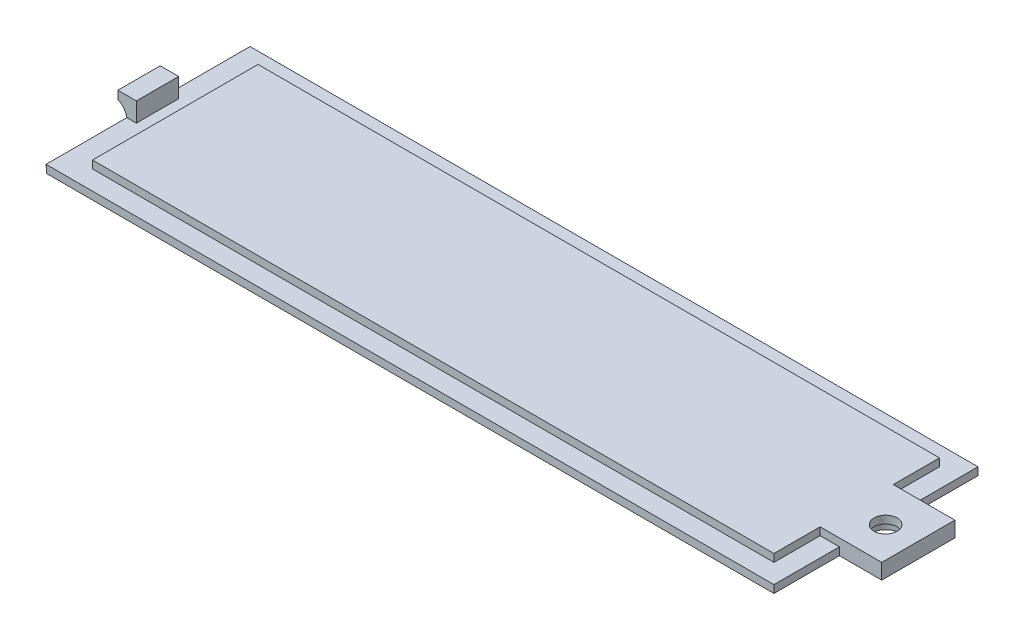
from build123d import *

# Parameters (mm, degrees)
BOSS_EXTRUDE1_DEPTH     = 1
CUT_EXTRUDE3_DEPTH      = 104.456512603
CUT_EXTRUDE3_DEPTH_BACK = 104.456512603
SKETCH6_R               = 2
SKETCH2_W               = 88.5
SKETCH2_H               = 21.5
BOSS_EXTRUDE2_DEPTH     = 1
SKETCH3_W               = 1.2
SKETCH3_H               = 5.5
BOSS_EXTRUDE3_DEPTH     = 2.5
SKETCH7_W               = 8
SKETCH7_H               = 9.5
BOSS_EXTRUDE4_DEPTH     = 1
SKETCH8_R               = 1.5
CUT_EXTRUDE4_DEPTH      = 3
SKETCH9_W               = 5.5
SKETCH9_H               = 1.039758998
BOSS_EXTRUDE5_DEPTH     = 1.2
FILLET3_START           = -16
FILLET3_DEPTH           = 5.5
FILLET3_START_2         = -26.5
FILLET3_2_DEPTH         = 26.5


with BuildPart() as part:
    # Sketch1 → Boss-Extrude1 (new body)
    with BuildSketch(Plane(origin=(0, 0, 0), x_dir=(1, 0, 0), z_dir=(0, 1, 0))):
        Polygon((94.5, 18), (100, 18), (100, 8.5), (94.5, 8.5), (94.5, 0), (0, 0), (0, 26.5), (94.5, 26.5), align=None)
    extrude(amount=BOSS_EXTRUDE1_DEPTH)

    # Sketch6 → Cut-Extrude3 (cut, two sides: drawn at the far end of the back side and taken through both)
    with BuildSketch(Plane(origin=(0, 1, 0), x_dir=(1, 0, 0), z_dir=(0, 1, 0)).offset(-CUT_EXTRUDE3_DEPTH_BACK)):
        with Locations(Location((96, 13, 0), (0, 0, 270))):
            Circle(SKETCH6_R)
    extrude(amount=CUT_EXTRUDE3_DEPTH + CUT_EXTRUDE3_DEPTH_BACK, mode=Mode.SUBTRACT)

    # Sketch2 → Boss-Extrude2 (add)
    with BuildSketch(Plane(origin=(0, 1, 0), x_dir=(1, 0, 0), z_dir=(0, 1, 0))):
        with Locations((47.75, 13.25)):
            Rectangle(SKETCH2_W, SKETCH2_H)
    extrude(amount=BOSS_EXTRUDE2_DEPTH)

    # Sketch3 → Boss-Extrude3 (add)
    with BuildSketch(Plane(origin=(0, 1, 0), x_dir=(1, 0, 0), z_dir=(0, 1, 0))):
        with Locations((0.6, 13.25)):
            Rectangle(SKETCH3_W, SKETCH3_H)
    extrude(amount=BOSS_EXTRUDE3_DEPTH)

    # Sketch7 → Boss-Extrude4 (add)
    with BuildSketch(Plane(origin=(0, 1, 0), x_dir=(1, 0, 0), z_dir=(0, 1, 0))):
        with Locations((96, 13.25)):
            Rectangle(SKETCH7_W, SKETCH7_H)
    extrude(amount=BOSS_EXTRUDE4_DEPTH)

    # Sketch8 → Cut-Extrude4 (cut)
    with BuildSketch(Plane.XZ.offset(-1)):
        with Locations(Location((96, -13, 0), (0, 0, 270))):
            Circle(SKETCH8_R)
    extrude(amount=-CUT_EXTRUDE4_DEPTH, mode=Mode.SUBTRACT)

    # Sketch9 → Boss-Extrude5 (add)
    with BuildSketch(Plane.ZY):
        with Locations((-13.25, 2.980120501)):
            Rectangle(SKETCH9_W, SKETCH9_H)
    extrude(amount=BOSS_EXTRUDE5_DEPTH)

    # Fillet3: read off the stored shape, not the designer's step
    # Fillet3 outline → Fillet3 (add)
    with BuildSketch(Plane.XY.offset(FILLET3_START)):
        with BuildLine():
            Line((0, 0.627210724), (0, 2.460241002))
            Line((0, 2.460241002), (-1.2, 2.460241002))
            ThreePointArc((-1.2, 2.460241002), (-0.326679947, 1.722655839), (0, 0.627210724))
        make_face()
    extrude(amount=FILLET3_DEPTH)

    # Fillet3 2 outline → Fillet3 2 (add)
    with BuildSketch(Plane.XY.offset(FILLET3_START_2)):
        with BuildLine():
            ThreePointArc((-0.035050088, 1), (-0.008781802, 0.814427412), (0, 0.627210724))
            Line((0, 0.627210724), (0, 1))
            Line((0, 1), (-0.035050088, 1))
        make_face()
    extrude(amount=FILLET3_2_DEPTH)


solid = part.part
